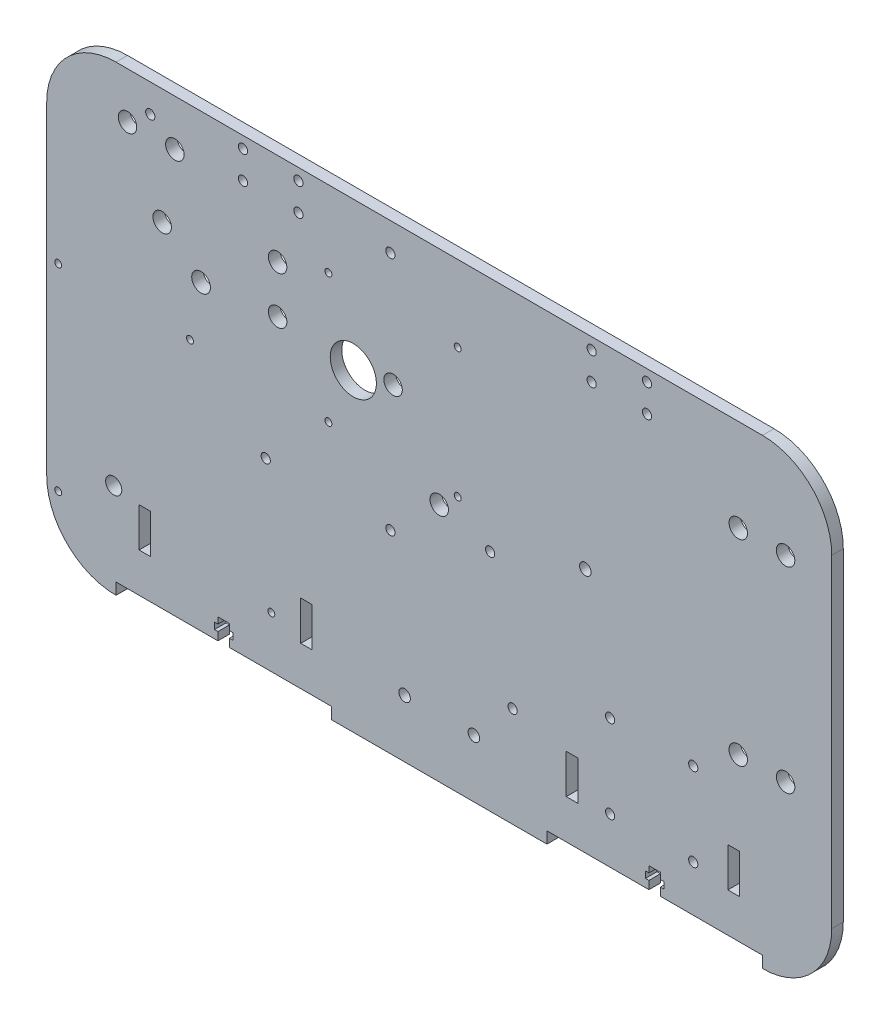
from build123d import *

# Parameters (mm, degrees)
SALIENTE_EXTRUIR1_DEPTH = 5
CROQUIS2_R              = 4
CORTAR_EXTRUIR4_DEPTH   = 10
CROQUIS3_R              = 2
CROQUIS3_R_2            = 10
CROQUIS3_R_3            = 4.05
CORTAR_EXTRUIR5_DEPTH   = 10
CROQUIS5_R              = 1.5
CORTAR_EXTRUIR6_DEPTH   = 10
CROQUIS6_R              = 2
CORTAR_EXTRUIR7_DEPTH   = 10
CROQUIS8_R              = 2
CORTAR_EXTRUIR8_DEPTH   = 10
CROQUIS9_R              = 3.5
CROQUIS9_R_2            = 1.5
CROQUIS9_R_3            = 2.5
CROQUIS9_R_4            = 2
CORTAR_EXTRUIR9_DEPTH   = 10
CROQUIS10_W             = 93.333333333
CROQUIS10_H             = 5
CORTAR_EXTRUIR10_DEPTH  = 10
CORTAR_EXTRUIR14_DEPTH  = 5
CROQUIS13_W             = 5
CROQUIS13_H             = 17
CORTAR_EXTRUIR15_DEPTH  = 5
CROQUIS14_R             = 2.5
CORTAR_EXTRUIR16_DEPTH  = 10


with BuildPart() as part:
    # Croquis1 → Saliente-Extruir1 (new body)
    with BuildSketch(Plane.XY):
        with BuildLine():
            Line((30, 0), (310, 0))
            ThreePointArc((310, 0), (331.213203436, 8.786796564), (340, 30))
            Line((340, 30), (340, 170))
            ThreePointArc((340, 170), (331.213203436, 191.213203436), (310, 200))
            Line((310, 200), (30, 200))
            ThreePointArc((30, 200), (8.786796564, 191.213203436), (0, 170))
            Line((0, 170), (0, 30))
            ThreePointArc((0, 30), (8.786796564, 8.786796564), (30, 0))
        make_face()
    extrude(amount=SALIENTE_EXTRUIR1_DEPTH)

    # Croquis2 → Cortar-Extruir4 (cut)
    with BuildSketch(Plane(origin=(0, 0, 5), x_dir=(-1, 0, 0), z_dir=(0, 0, -1))):
        with Locations((-55.5, 180)):
            Circle(CROQUIS2_R)
        with Locations((-35, 180)):
            Circle(CROQUIS2_R)
        with Locations((-100, 160)):
            Circle(CROQUIS2_R)
        with Locations((-100, 139.5)):
            Circle(CROQUIS2_R)
        with Locations((-299.5, 160)):
            Circle(CROQUIS2_R)
        with Locations((-320, 160)):
            Circle(CROQUIS2_R)
        with Locations((-320, 75)):
            Circle(CROQUIS2_R)
        with Locations((-299.5, 75)):
            Circle(CROQUIS2_R)
        with Locations((-150, 139)):
            Circle(CROQUIS2_R)
        with Locations((-170, 104)):
            Circle(CROQUIS2_R)
        with Locations((-50, 150)):
            Circle(CROQUIS2_R)
    extrude(amount=CORTAR_EXTRUIR4_DEPTH, mode=Mode.SUBTRACT)

    # Croquis3 → Cortar-Extruir5 (cut)
    with BuildSketch(Plane(origin=(0, 0, 0), x_dir=(-1, 0, 0), z_dir=(0, 0, -1))):
        with Locations((-148.85, 83.84)):
            Circle(CROQUIS3_R)
        with Locations((-94.85, 83.84)):
            Circle(CROQUIS3_R)
        with Locations((-44.85, 187.84)):
            Circle(CROQUIS3_R)
        with Locations((-148.85, 187.84)):
            Circle(CROQUIS3_R)
        with Locations((-132.79, 135.84)):
            Circle(CROQUIS3_R_2)
        with Locations((-66.85, 135.84)):
            Circle(CROQUIS3_R_3)
    extrude(amount=-CORTAR_EXTRUIR5_DEPTH, mode=Mode.SUBTRACT)

    # Croquis5 → Cortar-Extruir6 (cut)
    with BuildSketch(Plane(origin=(0, 0, 0), x_dir=(-1, 0, 0), z_dir=(0, 0, -1))):
        with Locations((-178, 167)):
            Circle(CROQUIS5_R)
        with Locations((-122, 111)):
            Circle(CROQUIS5_R)
        with Locations((-122, 167)):
            Circle(CROQUIS5_R)
        with Locations((-178, 111)):
            Circle(CROQUIS5_R)
    extrude(amount=-CORTAR_EXTRUIR6_DEPTH, mode=Mode.SUBTRACT)

    # Croquis6 → Cortar-Extruir7 (cut)
    with BuildSketch(Plane.XY.offset(5)):
        with Locations((244, 61)):
            Circle(CROQUIS6_R)
        with Locations((280, 61)):
            Circle(CROQUIS6_R)
        with Locations((244, 25)):
            Circle(CROQUIS6_R)
        with Locations((280, 25)):
            Circle(CROQUIS6_R)
    extrude(amount=-CORTAR_EXTRUIR7_DEPTH, mode=Mode.SUBTRACT)

    # Croquis8 → Cortar-Extruir8 (cut)
    with BuildSketch(Plane.XY.offset(5)):
        with Locations((236, 195)):
            Circle(CROQUIS8_R)
        with Locations((236, 183)):
            Circle(CROQUIS8_R)
        with Locations((260, 183)):
            Circle(CROQUIS8_R)
        with Locations((260, 195)):
            Circle(CROQUIS8_R)
        with Locations((85, 195)):
            Circle(CROQUIS8_R)
        with Locations((85, 183)):
            Circle(CROQUIS8_R)
        with Locations((109, 183)):
            Circle(CROQUIS8_R)
        with Locations((109, 195)):
            Circle(CROQUIS8_R)
    extrude(amount=-CORTAR_EXTRUIR8_DEPTH, mode=Mode.SUBTRACT)

    # Croquis9 → Cortar-Extruir9 (cut)
    with BuildSketch(Plane(origin=(0, 0, 0), x_dir=(-1, 0, 0), z_dir=(0, 0, -1))):
        with Locations((-29.01, 40.656502357)):
            Circle(CROQUIS9_R)
        with Locations((-62.080404779, 111.910005093)):
            Circle(CROQUIS9_R_2)
        with Locations((-4.98, 111.910005093)):
            Circle(CROQUIS9_R_2)
        with Locations((-97.280894834, 27.160005093)):
            Circle(CROQUIS9_R_2)
        with Locations((-4.98, 26.56)):
            Circle(CROQUIS9_R_2)
        with Locations((-233.296749654, 111.494889841)):
            Circle(CROQUIS9_R_3)
        with Locations((-201.8, 43.4)):
            Circle(CROQUIS9_R_4)
        with Locations((-192.05, 97.413240345)):
            Circle(CROQUIS9_R_4)
    extrude(amount=-CORTAR_EXTRUIR9_DEPTH, mode=Mode.SUBTRACT)

    # Croquis10 → Cortar-Extruir10 (cut)
    with BuildSketch(Plane.XY.offset(5)):
        with Locations((76.666666667, 2.5)):
            Rectangle(CROQUIS10_W, CROQUIS10_H)
        with Locations((263.333333334, 2.5)):
            Rectangle(CROQUIS10_W, CROQUIS10_H)
    extrude(amount=-CORTAR_EXTRUIR10_DEPTH, mode=Mode.SUBTRACT)

    # Croquis12 → Cortar-Extruir14 (cut)
    with BuildSketch(Plane.XY.offset(5)):
        Polygon((74.166666667, 5), (74.166666667, 8.5), (72.666666667, 8.5), (72.666666667, 11.3), (74.166666667, 11.3), (74.166666667, 14), (79.166666667, 14), (79.166666667, 11.3), (80.666666667, 11.3), (80.666666667, 8.5), (79.166666667, 8.5), (79.166666667, 5), align=None)
        Polygon((260.833333333, 11.3), (260.833333333, 14), (265.833333333, 14), (265.833333333, 11.3), (267.333333333, 11.3), (267.333333333, 8.5), (265.833333333, 8.5), (265.833333333, 5), (260.833333333, 5), (260.833333333, 8.5), (259.333333333, 8.5), (259.333333333, 11.3), align=None)
    extrude(amount=-CORTAR_EXTRUIR14_DEPTH, mode=Mode.SUBTRACT)

    # Croquis13 → Cortar-Extruir15 (cut)
    with BuildSketch(Plane.XY.offset(5)):
        with Locations((112.5, 30.5)):
            Rectangle(CROQUIS13_W, CROQUIS13_H)
        with Locations((227.5, 30.5)):
            Rectangle(CROQUIS13_W, CROQUIS13_H)
        with Locations((42.5, 30.5)):
            Rectangle(CROQUIS13_W, CROQUIS13_H)
        with Locations((297.5, 30.5)):
            Rectangle(CROQUIS13_W, CROQUIS13_H)
    extrude(amount=-CORTAR_EXTRUIR15_DEPTH, mode=Mode.SUBTRACT)

    # Croquis14 → Cortar-Extruir16 (cut)
    with BuildSketch(Plane.XY.offset(5)):
        with Locations((155, 25)):
            Circle(CROQUIS14_R)
        with Locations((185, 25)):
            Circle(CROQUIS14_R)
    extrude(amount=-CORTAR_EXTRUIR16_DEPTH, mode=Mode.SUBTRACT)


solid = part.part
